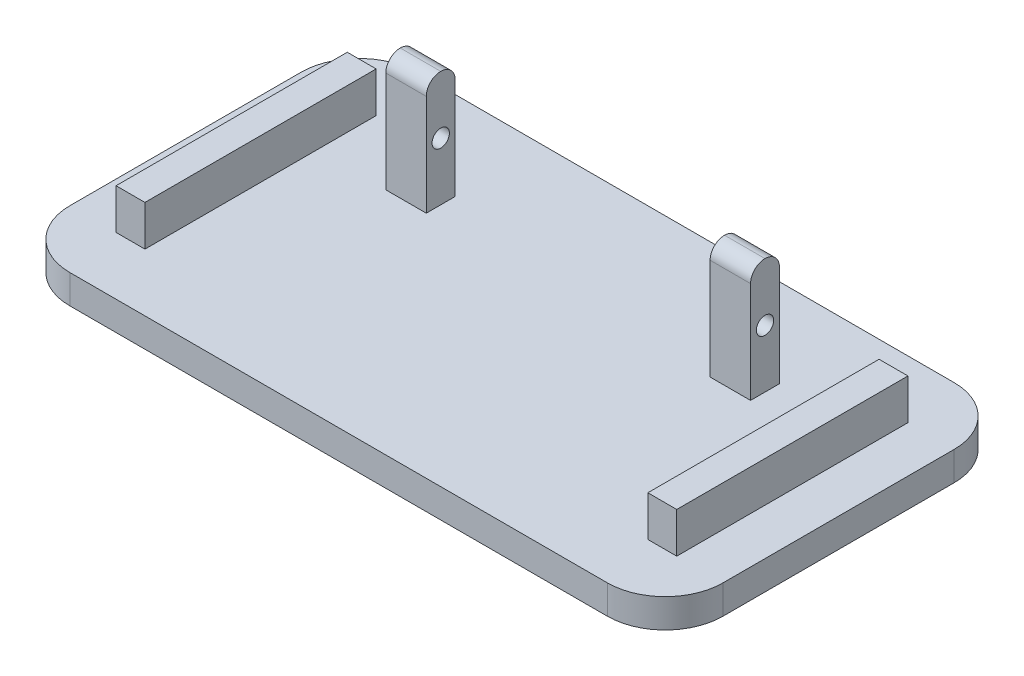
from build123d import *

# Parameters (mm, degrees)
RESSALTO_EXTRUS_O1_DEPTH = 5
ESBO_O2_W                = 7
ESBO_O2_H                = 5
RESSALTO_EXTRUS_O2_DEPTH = 20
ESBO_O4_R                = 1.5
CORTE_EXTRUS_O1_DEPTH    = 102.759991649
ESBO_O5_W                = 5
ESBO_O5_H                = 40
RESSALTO_EXTRUS_O3_DEPTH = 7
FILETE1_R                = 2.5
FILETE2_R                = 2.5
FILETE3_R                = 2.5


with BuildPart() as part:
    # Esboço1 → Ressalto-extrusão1 (new body)
    with BuildSketch(Plane(origin=(0, 0, 0), x_dir=(1, 0, 0), z_dir=(0, 1, 0))):
        with BuildLine():
            Line((-13.214501511, 15.533232628), (79.785498489, 15.533232628))
            ThreePointArc((79.785498489, 15.533232628), (86.856566301, 12.60430044), (89.785498489, 5.533232628))
            Line((89.785498489, 5.533232628), (89.785498489, -34.466767372))
            ThreePointArc((89.785498489, -34.466767372), (86.856566301, -41.537835183), (79.785498489, -44.466767372))
            Line((79.785498489, -44.466767372), (-13.214501511, -44.466767372))
            ThreePointArc((-13.214501511, -44.466767372), (-20.285569322, -41.537835183), (-23.214501511, -34.466767372))
            Line((-23.214501511, -34.466767372), (-23.214501511, 5.533232628))
            ThreePointArc((-23.214501511, 5.533232628), (-20.285569322, 12.60430044), (-13.214501511, 15.533232628))
        make_face()
    extrude(amount=RESSALTO_EXTRUS_O1_DEPTH)

    # Esboço2 → Ressalto-extrusão2 (add)
    with BuildSketch(Plane(origin=(0, 5, 0), x_dir=(1, 0, 0), z_dir=(0, 1, 0))):
        with Locations((61.335498489, -2.247557162)):
            Rectangle(ESBO_O2_W, ESBO_O2_H)
        with Locations((5.235498489, -2.247557162)):
            Rectangle(ESBO_O2_W, ESBO_O2_H)
    extrude(amount=RESSALTO_EXTRUS_O2_DEPTH)

    # Esboço4 → Corte-extrusão1 (cut, through all)
    with BuildSketch(Plane.ZY.offset(-1.735498489)):
        with Locations((2.247557162, 15)):
            Circle(ESBO_O4_R)
    extrude(amount=-CORTE_EXTRUS_O1_DEPTH, mode=Mode.SUBTRACT)

    # Esboço5 → Ressalto-extrusão3 (add)
    with BuildSketch(Plane(origin=(0, 5, 0), x_dir=(1, 0, 0), z_dir=(0, 1, 0))):
        with Locations((-12.714501511, -14.466767372)):
            Rectangle(ESBO_O5_W, ESBO_O5_H)
        with Locations((79.285498489, -14.466767372)):
            Rectangle(ESBO_O5_W, ESBO_O5_H)
    extrude(amount=RESSALTO_EXTRUS_O3_DEPTH)

    # Filete1
    filete1_edges = [part.edges().sort_by_distance(p)[0] for p in [
        (5.235498489, 25, -0.252442838),
    ]]
    fillet(filete1_edges, radius=FILETE1_R)

    # Filete2
    filete2_edges = [part.edges().sort_by_distance(p)[0] for p in [
        (5.235498489, 25, 4.747557162),
    ]]
    fillet(filete2_edges, radius=FILETE2_R - 0.0001)  # a hair under: the kernel refuses the full size

    # Filete3
    filete3_edges = [part.edges().sort_by_distance(p)[0] for p in [
        (61.335498489, 25, 4.747557162),
        (61.335498489, 25, -0.252442838),
    ]]
    fillet(filete3_edges, radius=FILETE3_R - 0.0001)  # a hair under: the kernel refuses the full size


solid = part.part
